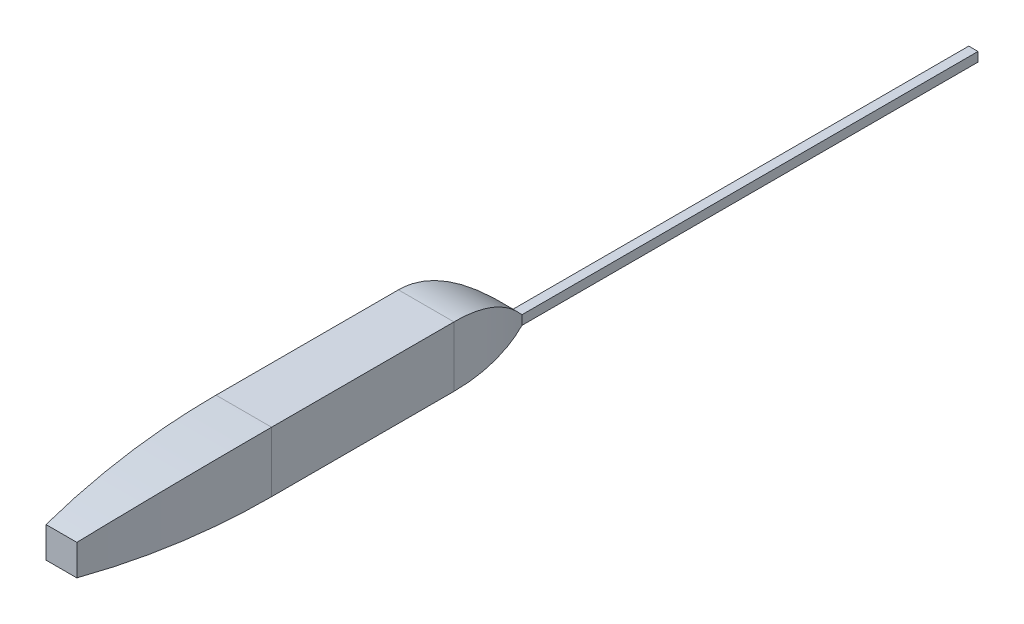
from build123d import *

# Parameters (mm, degrees)
BOSS_EXTRUDE1_DEPTH      = 50
BOSS_EXTRUDE1_DEPTH_BACK = 50
CUT_EXTRUDE1_DEPTH       = 50
CUT_EXTRUDE1_DEPTH_BACK  = 50
SKETCH3_OUTSIDE_W        = 1185.376
SKETCH3_OUTSIDE_H        = 300.376


with BuildPart() as part:
    # Sketch4 → Boss-Extrude1 (new, two sides: drawn at the far end of the back side and taken through both)
    with BuildSketch(Plane(origin=(0, 0, 0), x_dir=(1, 0, 0), z_dir=(0, 1, 0)).offset(-BOSS_EXTRUDE1_DEPTH_BACK)):
        with BuildLine():
            Line((-16.642135624, 0), (16.642135624, 0))
            add(Edge.make_bspline(
                [(30, 197), (30, 98.5), (16.642135624, 0)],
                knots=[0, 0, 0, 1, 1, 1], degree=2))
            Line((30, 197), (30, 394))
            add(Edge.make_bspline(
                [(30, 394), (30, 442.25), (5, 492.5)],
                knots=[0, 0, 0, 1, 1, 1], degree=2))
            Line((5, 492.5), (5, 985))
            Line((5, 985), (-5, 985))
            Line((-5, 985), (-5, 492.5))
            add(Edge.make_bspline(
                [(-30, 394), (-30, 442.25), (-5, 492.5)],
                knots=[0, 0, 0, 1, 1, 1], degree=2))
            Line((-30, 394), (-30, 197))
            add(Edge.make_bspline(
                [(-30, 197), (-30, 98.5), (-16.642135624, 0)],
                knots=[0, 0, 0, 1, 1, 1], degree=2))
        make_face()
    extrude(amount=BOSS_EXTRUDE1_DEPTH + BOSS_EXTRUDE1_DEPTH_BACK)

    # Sketch3 outside → Cut-Extrude1 (cut, two sides: drawn at the far end of the back side and taken through both)
    with BuildSketch(Plane(origin=(0, 0, 0), x_dir=(0, 0, -1), z_dir=(1, 0, 0)).offset(-CUT_EXTRUDE1_DEPTH_BACK)):
        with Locations((492.5, 0)):
            Rectangle(SKETCH3_OUTSIDE_W, SKETCH3_OUTSIDE_H)
        with BuildLine():
            Line((394, -32.5), (985, -32.5))
            Line((985, -32.5), (985, -22.5))
            Line((985, -22.5), (492.5, -22.5))
            add(Edge.make_bspline(
                [(394, 32.5), (442.25, 32.5), (492.5, -22.5)],
                knots=[0, 0, 0, 1, 1, 1], degree=2))
            Line((394, 32.5), (197, 32.5))
            add(Edge.make_bspline(
                [(0, 16.642135624), (98.5, 32.5), (197, 32.5)],
                knots=[0, 0, 0, 1, 1, 1], degree=2))
            Line((0, 16.642135624), (0, -16.642135624))
            add(Edge.make_bspline(
                [(0, -16.642135624), (98.5, -32.5), (197, -32.5)],
                knots=[0, 0, 0, 1, 1, 1], degree=2))
            Line((197, -32.5), (394, -32.5))
        make_face(mode=Mode.SUBTRACT)
    extrude(amount=CUT_EXTRUDE1_DEPTH + CUT_EXTRUDE1_DEPTH_BACK, mode=Mode.SUBTRACT)


solid = part.part
